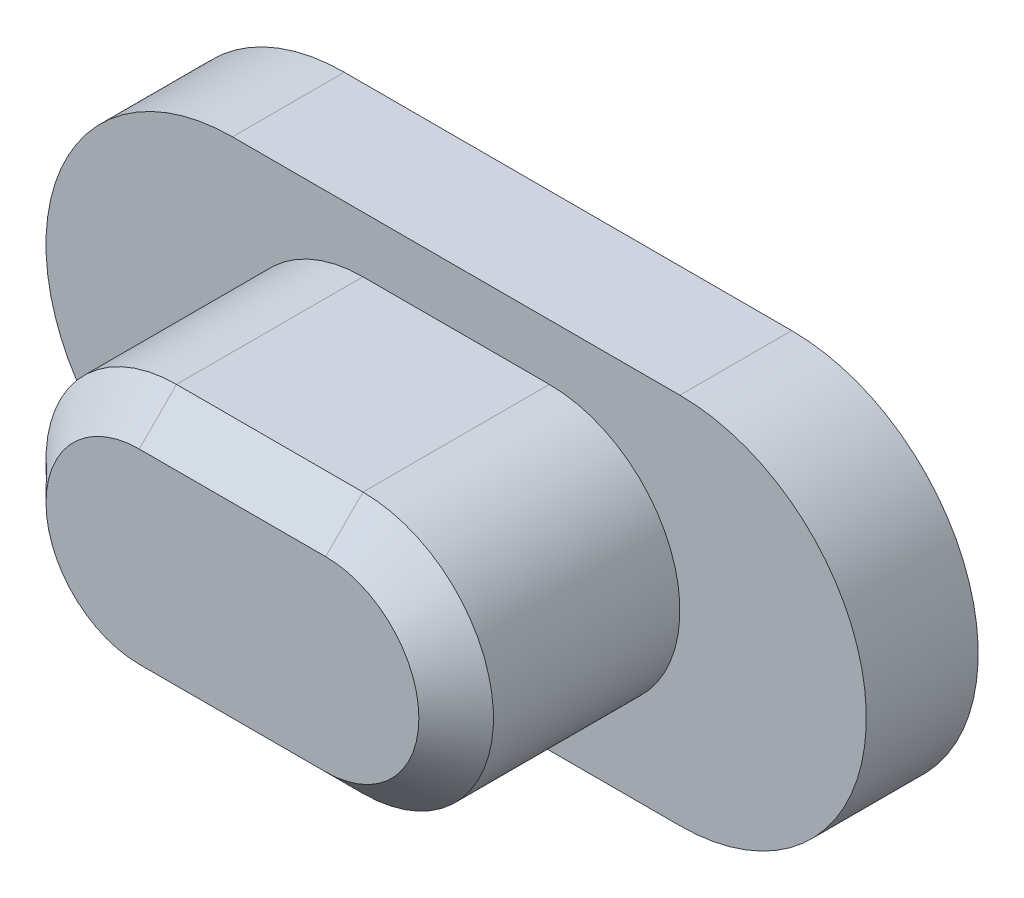
from build123d import *

# Parameters (mm, degrees)
EXTRUDE_1_DEPTH     = 3
EXTRUDE_2_DEPTH     = 6
CUT_EXTRUDE_1_DEPTH = 4
CHAMFER_1_SIZE      = 1


with BuildPart() as part:
    # Эскиз1 → Бобышка-Вытянуть1 (new body)
    with BuildSketch(Plane.XY):
        with BuildLine():
            Line((-6, 5), (6, 5))
            ThreePointArc((6, 5), (11, 0), (6, -5))
            Line((6, -5), (-6, -5))
            ThreePointArc((-6, -5), (-11, 0), (-6, 5))
        make_face()
    extrude(amount=EXTRUDE_1_DEPTH)

    # Эскиз2 → Бобышка-Вытянуть2 (add)
    with BuildSketch(Plane.XY.offset(3)):
        with BuildLine():
            Line((-2.5, 3.5), (2.5, 3.5))
            ThreePointArc((2.5, 3.5), (6, 0), (2.5, -3.5))
            Line((2.5, -3.5), (-2.5, -3.5))
            ThreePointArc((-2.5, -3.5), (-6, 0), (-2.5, 3.5))
        make_face()
    extrude(amount=EXTRUDE_2_DEPTH)

    # Эскиз3 → Вырез-Вытянуть1 (cut)
    with BuildSketch(Plane(origin=(0, 0, 0), x_dir=(-1, 0, 0), z_dir=(0, 0, -1))):
        with BuildLine():
            Line((0.75, -2), (-0.75, -2))
            ThreePointArc((-0.75, -2), (-2.75, 0), (-0.75, 2))
            Line((-0.75, 2), (0.75, 2))
            ThreePointArc((0.75, 2), (2.75, 0), (0.75, -2))
        make_face()
    extrude(amount=-CUT_EXTRUDE_1_DEPTH, mode=Mode.SUBTRACT)

    # Фаска1
    chamfer_1_edges = [part.edges().sort_by_distance(p)[0] for p in [
        (0, 3.5, 9),
        (-6, 0, 9),
        (6, 0, 9),
        (0, -3.5, 9),
    ]]
    chamfer(chamfer_1_edges, length=CHAMFER_1_SIZE)


solid = part.part
